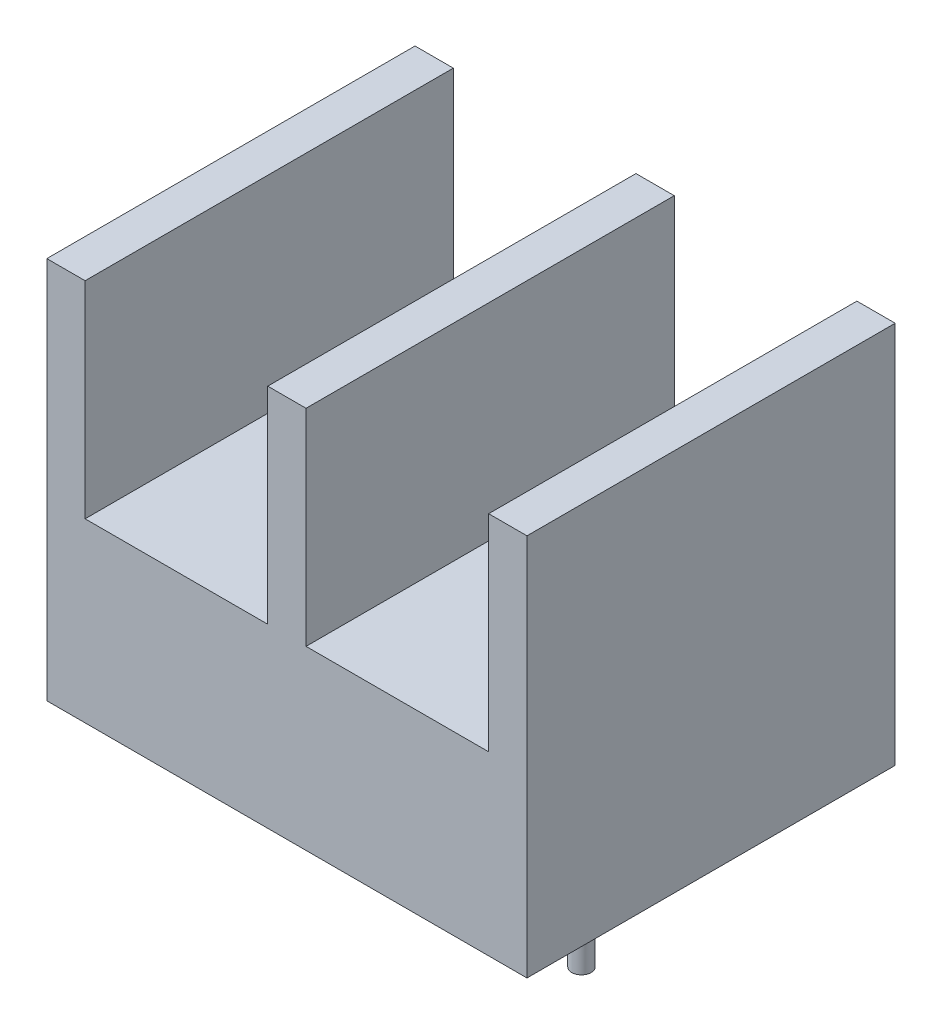
from build123d import *

# Parameters (mm, degrees)
SKETCH1_W           = 20.701
SKETCH1_H           = 15.875
BOSS_EXTRUDE1_DEPTH = 16.51
SKETCH2_R           = 0.4191
BOSS_EXTRUDE2_DEPTH = 6.35
SKETCH3_W           = 7.874
SKETCH3_H           = 8.89
CUT_EXTRUDE1_DEPTH  = 26.134211252


with BuildPart() as part:
    # Sketch1 → Boss-Extrude1 (new body)
    with BuildSketch(Plane(origin=(0, 0, 0), x_dir=(1, 0, 0), z_dir=(0, 1, 0))):
        Rectangle(SKETCH1_W, SKETCH1_H)
    extrude(amount=BOSS_EXTRUDE1_DEPTH)

    # Sketch2 → Boss-Extrude2 (add)
    with BuildSketch(Plane(origin=(0, 0, 0), x_dir=(-1, 0, 0), z_dir=(0, -1, 0))):
        with Locations((4.7625, 0)):
            Circle(SKETCH2_R)
        with Locations((-4.7625, 0)):
            Circle(SKETCH2_R)
    extrude(amount=BOSS_EXTRUDE2_DEPTH)

    # Sketch3 → Cut-Extrude1 (cut, through all)
    with BuildSketch(Plane(origin=(0, 0, -7.9375), x_dir=(-1, 0, 0), z_dir=(0, 0, -1))):
        with Locations((-4.7625, 12.065)):
            Rectangle(SKETCH3_W, SKETCH3_H)
        with Locations((4.7625, 12.065)):
            Rectangle(SKETCH3_W, SKETCH3_H)
    extrude(amount=-CUT_EXTRUDE1_DEPTH, mode=Mode.SUBTRACT)


solid = part.part
